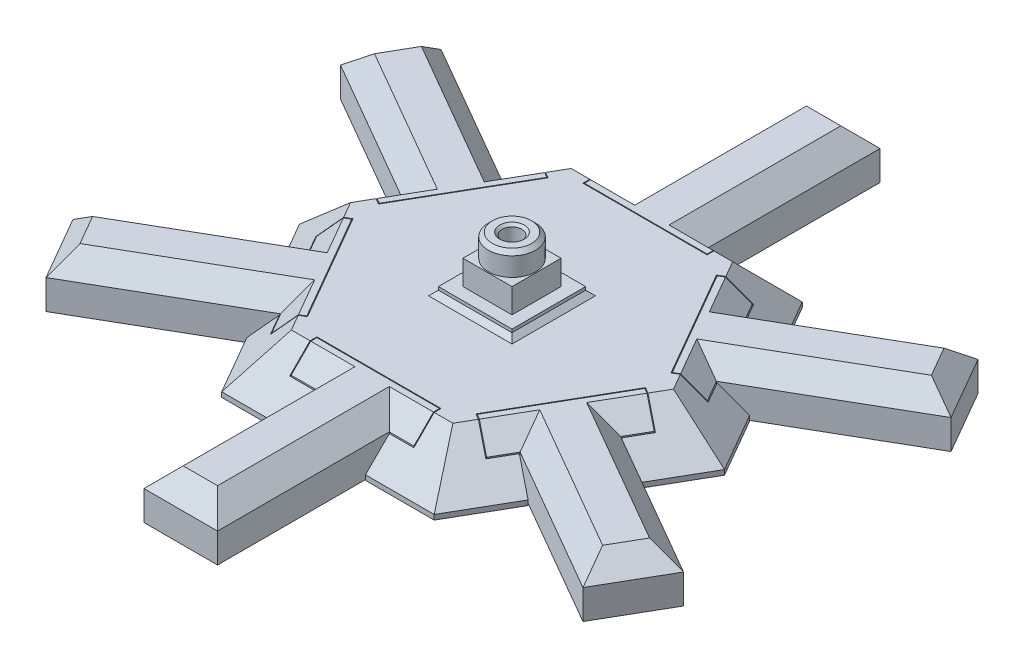
from build123d import *

# Parameters (mm, degrees)
BASE_EXTRUDE_DEPTH           = 10
BOSS_EXTRUDE2_START          = 10
SKETCH3_W                    = 10
SKETCH3_H                    = 10
BOSS_EXTRUDE2_DEPTH          = 11.25
BOSS_EXTRUDE3_START          = 10
SKETCH4_W                    = 15
SKETCH4_H                    = 15
BOSS_EXTRUDE3_DEPTH          = 1.64
CUT_EXTRUDE1_DEPTH           = 5
CUT_EXTRUDE1_DEPTH_BACK      = 62.096747049
CUT_EXTRUDE1_START           = 11.64
SKETCH5_R                    = 2
SKETCH5_2_R                  = 2
CUT_EXTRUDE2_DEPTH           = 62.096747049
CUT_EXTRUDE3_DEPTH           = 4.61
CHAMFER1_SIZE                = 1
F_2_START                    = 16.64
F_2_OFFSET_ROT_OUTLINE_R     = 5
F_2_OFFSET_ROT_OUTLINE_R_2   = 4.8
F_2_OFFSET_ROT_DEPTH         = 4.6100001
F_15_START                   = -1
F_15_OFFSET_HEX_DEPTH        = 17.64
CHAMFER8_SIZE                = 9
CHAMFER9_SIZE                = 1
CHAMFER10_SIZE               = 1
CHAMFER11_SIZE               = 0.5
BOSS_EXTRUDE10_DEPTH         = 10
CHAMFER12_SIZE               = 10
CHAMFER12_SIZE_2             = 1.763269807
CHAMFER13_SIZE               = 4
CHAMFER14_SIZE               = 4
MAKE_START                   = -63.5
MAKE_TOOL_DEPTH              = 36.236730193
MAKE_START_2                 = -28.5
MAKE_TOOL_2_DEPTH            = 1.236730193
MAKE_START_3                 = -7.5
MAKE_TOOL_3_DEPTH            = 15
MAKE_START_4                 = -12.5
MAKE_TOOL_4_DEPTH            = 25
MAKE_START_5                 = -68
MAKE_TOOL_5_DEPTH            = 4.5
DUPLICATE_TOOL_COUNT         = 6
F_15_START_2                 = -12.65
F_15_OFFSET_FOR_FEET_DEPTH   = 25.3
F_15_START_3                 = -7.65
F_15_OFFSET_FOR_FEET_2_DEPTH = 15.3
F_15_OFFSET_FOR_FEET_3_DEPTH = 25.3
F_15_OFFSET_FOR_FEET_4_DEPTH = 15.3
F_15_OFFSET_FOR_FEET_5_DEPTH = 25.3
F_15_OFFSET_FOR_FEET_6_DEPTH = 15.3
DUPLICATE_FEET_COUNT         = 6


with BuildPart() as part:
    # Sketch1 → Base Extrude (new body)
    with BuildSketch(Plane(origin=(0, 0, 0), x_dir=(1, 0, 0), z_dir=(0, 1, 0))):
        Polygon((43.301270189, 0), (21.650635095, 37.5), (-21.650635095, 37.5), (-43.301270189, 0), (-21.650635095, -37.5), (21.650635095, -37.5), align=None)
    extrude(amount=BASE_EXTRUDE_DEPTH)

    # Sketch3 → Boss-Extrude2 (add)
    with BuildSketch(Plane(origin=(0, 0, 0), x_dir=(1, 0, 0), z_dir=(0, 1, 0)).offset(BOSS_EXTRUDE2_START)):
        Rectangle(SKETCH3_W, SKETCH3_H)
    extrude(amount=BOSS_EXTRUDE2_DEPTH)

    # Sketch4 → Boss-Extrude3 (add)
    with BuildSketch(Plane(origin=(0, 0, 0), x_dir=(1, 0, 0), z_dir=(0, 1, 0)).offset(BOSS_EXTRUDE3_START)):
        Rectangle(SKETCH4_W, SKETCH4_H)
    extrude(amount=BOSS_EXTRUDE3_DEPTH)

    # Sketch5 → Cut-Extrude1 (cut, two sides: drawn at the far end of the back side and taken through both)
    with BuildSketch(Plane(origin=(0, 0, 0), x_dir=(1, 0, 0), z_dir=(0, 1, 0)).offset(CUT_EXTRUDE1_START - CUT_EXTRUDE1_DEPTH_BACK)):
        Polygon((4.445597073, 0), (2.222798536, 3.85), (-2.222798536, 3.85), (-4.445597073, 0), (-2.222798536, -3.85), (2.222798536, -3.85), align=None)
        with Locations(Location((0, 0, 0), (0, 0, 270))):
            Circle(SKETCH5_R, mode=Mode.SUBTRACT)
    extrude(amount=CUT_EXTRUDE1_DEPTH + CUT_EXTRUDE1_DEPTH_BACK, mode=Mode.SUBTRACT)

    # Sketch5<2> → Cut-Extrude2 (cut, through all)
    with BuildSketch(Plane(origin=(0, 0, 0), x_dir=(1, 0, 0), z_dir=(0, 1, 0))):
        with Locations(Location((0, 0, 0), (0, 0, 90))):
            Circle(SKETCH5_2_R)
    extrude(amount=CUT_EXTRUDE2_DEPTH, mode=Mode.SUBTRACT)

    # Sketch6 → Cut-Extrude3 (cut)
    with BuildSketch(Plane(origin=(0, 21.25, 0), x_dir=(1, 0, 0), z_dir=(0, 1, 0))):
        with BuildLine():
            Line((-5.7e-08, 5), (-5, 5))
            Line((-5, 5), (-5, 3e-09))
            ThreePointArc((-5, 3e-09), (-3.535533925, 3.535533887), (-5.7e-08, 5))
        make_face()
        with BuildLine():
            Line((5, 5), (-5.7e-08, 5))
            ThreePointArc((-5.7e-08, 5), (3.535533886, 3.535533926), (5, 0))
            Line((5, 0), (5, 5))
        make_face()
        with BuildLine():
            ThreePointArc((5, 0), (3.535533906, -3.535533906), (0, -5))
            Line((0, -5), (5, -5))
            Line((5, -5), (5, 0))
        make_face()
        with BuildLine():
            ThreePointArc((0, -5), (-3.535533907, -3.535533905), (-5, 3e-09))
            Line((-5, 3e-09), (-5, -5))
            Line((-5, -5), (0, -5))
        make_face()
    extrude(amount=-CUT_EXTRUDE3_DEPTH, mode=Mode.SUBTRACT)

    # Chamfer1
    chamfer1_edges = [part.edges().sort_by_distance(p)[0] for p in [
        (0, 21.25, -5),
    ]]
    chamfer(chamfer1_edges, length=CHAMFER1_SIZE)

    # .2 Offset, Rot: read off the stored shape, not the designer's step
    # .2 Offset, Rot outline → .2 Offset, Rot (cut)
    with BuildSketch(Plane(origin=(0, 0, 0), x_dir=(1, 0, 0), z_dir=(0, 1, 0)).offset(F_2_START)):
        Circle(F_2_OFFSET_ROT_OUTLINE_R)
        Circle(F_2_OFFSET_ROT_OUTLINE_R_2, mode=Mode.SUBTRACT)
    extrude(amount=F_2_OFFSET_ROT_DEPTH, mode=Mode.SUBTRACT)

    # .15 Offset, Hex: read off the stored shape, not the designer's step
    # .15 Offset, Hex outline → .15 Offset, Hex (cut)
    with BuildSketch(Plane(origin=(0, 0, 0), x_dir=(1, 0, 0), z_dir=(0, 1, 0)).offset(F_15_START)):
        Polygon((-4.618802154, 0), (-2.309401077, -4), (2.309401077, -4), (4.618802154, 0), (2.309401077, 4), (-2.309401077, 4), align=None)
        Polygon((2.222798536, -3.85), (-2.222798536, -3.85), (-4.445597073, 0), (-2.222798536, 3.85), (2.222798536, 3.85), (4.445597073, 0), align=None, mode=Mode.SUBTRACT)
    extrude(amount=F_15_OFFSET_HEX_DEPTH, mode=Mode.SUBTRACT)

    # Chamfer8
    chamfer8_edges = [part.edges().sort_by_distance(p)[0] for p in [
        (32.475952642, 10, 18.75),
        (32.475952642, 10, -18.75),
        (0, 10, -37.5),
        (-32.475952642, 10, -18.75),
        (-32.475952642, 10, 18.75),
        (0, 10, 37.5),
    ]]
    chamfer(chamfer8_edges, length=CHAMFER8_SIZE)

    # Chamfer9
    chamfer9_edges = [part.edges().sort_by_distance(p)[0] for p in [
        (-3.464101616, 0, 2),
        (-3.464101616, 0, -2),
        (0, 0, -4),
        (3.464101616, 0, -2),
        (3.464101616, 0, 2),
        (0, 0, 4),
    ]]
    chamfer(chamfer9_edges, length=CHAMFER9_SIZE)

    # Chamfer10
    chamfer10_edges = [part.edges().sort_by_distance(p)[0] for p in [
        (0, 10, 7.5),
        (7.5, 10, 0),
        (0, 10, -7.5),
        (-7.5, 10, 0),
    ]]
    chamfer(chamfer10_edges, length=CHAMFER10_SIZE)

    # Chamfer11
    chamfer11_edges = [part.edges().sort_by_distance(p)[0] for p in [
        (0, 21.25, 2),
    ]]
    chamfer(chamfer11_edges, length=CHAMFER11_SIZE)


with BuildPart() as body_2:
    # Boss-Extrude10: read off the stored shape, not the designer's step
    # Boss-Extrude10 outline → Boss-Extrude10 (new body)
    with BuildSketch(Plane(origin=(0, 0, 0), x_dir=(1, 0, 0), z_dir=(0, 1, 0))):
        Polygon((-24.395825623, 22.745190528), (-54.706714755, 40.245190528), (-62.206714755, 27.254809472), (-31.895825623, 9.754809472), (-34.395825623, 5.424682453), (-28.333647797, 1.924682453), (-15.833647797, 23.575317547), (-21.895825623, 27.075317547), align=None)
    extrude(amount=BOSS_EXTRUDE10_DEPTH)

    # Chamfer12
    # the kernel refuses this chamfer: 10, 1.763269807 mm, written as the material it takes off along each edge
    with BuildSketch(Plane(origin=(-41.326341779, 10, 20.579323651), x_dir=(0, -1, 0), z_dir=(0.5000000000105823, 0, -0.866025403778329))) as chamfer12_piece_1:
        Polygon((CHAMFER12_SIZE, 0), (0, CHAMFER12_SIZE_2), (0, 0), align=None)
    extrude(amount=76.970775928, mode=Mode.SUBTRACT)

    # Chamfer13
    chamfer13_edges = [body_2.edges().sort_by_distance(p)[0] for p in [
        (-47.051270189, 10, -18.504809472),
        (-39.551270189, 10, -31.495190528),
        (-58.456714755, 10, -33.75),
    ]]
    chamfer(chamfer13_edges, length=CHAMFER13_SIZE)

    # Chamfer14
    chamfer14_edges = [body_2.edges().sort_by_distance(p)[0] for p in [
        (-24.145825623, 10, -23.17820323),
        (-32.145825623, 10, -9.32179677),
    ]]
    chamfer(chamfer14_edges, length=CHAMFER14_SIZE)


with BuildPart() as body_3:
    # Make Tool: read off the stored shape, not the designer's step
    # Make Tool outline → Make Tool (new body)
    with BuildSketch(Plane(origin=(0, 0, 0), x_dir=(0.4999999999999988, 0, -0.8660254037844395), z_dir=(0.8660254037844393, 0, 0.4999999999999991)).offset(MAKE_START)):
        Polygon((-7.5, 6), (-7.5, 0), (7.5, 0), (7.5, 6), (3.5, 10), (-3.5, 10), align=None)
    extrude(amount=MAKE_TOOL_DEPTH)

    # Make Tool 2 outline → Make Tool 2 (add)
    with BuildSketch(Plane(origin=(0, 0, 0), x_dir=(0.4999999999999988, 0, -0.8660254037844395), z_dir=(0.8660254037844393, 0, 0.4999999999999991)).offset(MAKE_START_2)):
        Polygon((-12.5, 0), (-7.5, 0), (-7.5, 6), (-3.5, 10), (-12.5, 10), align=None)
        Polygon((7.5, 6), (7.5, 0), (12.5, 0), (12.5, 10), (3.5, 10), align=None)
    extrude(amount=MAKE_TOOL_2_DEPTH)

    # Make Tool 3 outline → Make Tool 3 (add)
    with BuildSketch(Plane(origin=(0, 0, 0), x_dir=(0.8660254037844384, 0, 0.5000000000000003), z_dir=(0.5000000000000003, 0, -0.8660254037844385)).offset(MAKE_START_3)):
        Polygon((-63.5, 0), (-67.5, 0), (-67.5, -6), (-63.5, -10), align=None)
        Polygon((-25.5, 0), (-27.263269807, 0), (-27.263269807, -10), align=None)
        Polygon((-28.5, 0), (-32.5, 0), (-32.5, -6), (-28.5, -10), align=None)
    extrude(amount=MAKE_TOOL_3_DEPTH)

    # Make Tool 4 outline → Make Tool 4 (add)
    with BuildSketch(Plane(origin=(0, 0, 0), x_dir=(0.8660254037844384, 0, 0.5000000000000003), z_dir=(0.5000000000000003, 0, -0.8660254037844385)).offset(MAKE_START_4)):
        Polygon((-25.5, 0), (-27.263269807, 0), (-27.263269807, -10), align=None)
        Polygon((-28.5, 0), (-32.5, 0), (-32.5, -6), (-28.5, -10), align=None)
    extrude(amount=MAKE_TOOL_4_DEPTH)

    # Make Tool 5 outline → Make Tool 5 (cut)
    with BuildSketch(Plane(origin=(0, 0, 0), x_dir=(0.4999999999999988, 0, -0.8660254037844394), z_dir=(0.8660254037844393, 0, 0.49999999999999906)).offset(MAKE_START_5)):
        Polygon((7.5, 10), (3.5, 10), (7.5, 6), align=None)
        Polygon((-3.5, 10), (-7.5, 10), (-7.5, 6), align=None)
    extrude(amount=MAKE_TOOL_5_DEPTH, mode=Mode.SUBTRACT)


with BuildPart() as duplicate_tool_1:
    # Duplicate Tool: pattern copy
    add(body_3.part.rotate(Axis((0, 0, 0), (0, 1, 0)), 1 * 360 / DUPLICATE_TOOL_COUNT))


with BuildPart() as duplicate_tool_2:
    # Duplicate Tool: pattern copy
    add(body_3.part.rotate(Axis((0, 0, 0), (0, 1, 0)), 2 * 360 / DUPLICATE_TOOL_COUNT))


with BuildPart() as duplicate_tool_3:
    # Duplicate Tool: pattern copy
    add(body_3.part.rotate(Axis((0, 0, 0), (0, 1, 0)), 3 * 360 / DUPLICATE_TOOL_COUNT))


with BuildPart() as duplicate_tool_4:
    # Duplicate Tool: pattern copy
    add(body_3.part.rotate(Axis((0, 0, 0), (0, 1, 0)), 4 * 360 / DUPLICATE_TOOL_COUNT))


with BuildPart() as duplicate_tool_5:
    # Duplicate Tool: pattern copy
    add(body_3.part.rotate(Axis((0, 0, 0), (0, 1, 0)), 5 * 360 / DUPLICATE_TOOL_COUNT))


with BuildPart() as part_1:
    add(part.part)

    # Make Feet Cutout: read off the stored shape, not the designer's step
    # Make Feet Cutout: cut Duplicate Tool_2, Duplicate Tool_3, Duplicate Tool_4, Duplicate Tool_5, Duplicate Tool_1, body 2
    add(duplicate_tool_2.part, mode=Mode.SUBTRACT)
    add(duplicate_tool_3.part, mode=Mode.SUBTRACT)
    add(duplicate_tool_4.part, mode=Mode.SUBTRACT)
    add(duplicate_tool_5.part, mode=Mode.SUBTRACT)
    add(duplicate_tool_1.part, mode=Mode.SUBTRACT)
    add(body_2.part, mode=Mode.SUBTRACT)

    # .15 Offset for feet: read off the stored shape, not the designer's step
    # .15 Offset for feet outline → .15 Offset for feet (cut)
    with BuildSketch(Plane(origin=(0, 0, 0), x_dir=(0.8660254037844386, 0, 0.4999999999999999), z_dir=(0.4999999999999999, 0, -0.8660254037844388)).offset(F_15_START_2)):
        Polygon((-32.65, 0), (-32.65, -5.85), (-28.5, -10), (-27.110955815, -10), (-25.347686008, 0), align=None)
        Polygon((25.347686008, 0), (27.110955815, -10), (28.5, -10), (32.65, -5.85), (32.65, 0), align=None)
    extrude(amount=F_15_OFFSET_FOR_FEET_DEPTH, mode=Mode.SUBTRACT)

    # 15 Offset for feet 2 outline → 15 Offset for feet 2 (cut)
    with BuildSketch(Plane(origin=(0, 0, 0), x_dir=(0.8660254037844386, 0, 0.4999999999999999), z_dir=(0.4999999999999999, 0, -0.8660254037844388)).offset(F_15_START_3)):
        Polygon((-37.5, -1), (-32.65, -5.85), (-32.65, 0), (-37.5, 0), align=None)
        Polygon((37.5, 0), (32.65, 0), (32.65, -5.85), (37.5, -1), align=None)
    extrude(amount=F_15_OFFSET_FOR_FEET_2_DEPTH, mode=Mode.SUBTRACT)

    # 15 Offset for feet 3 outline → 15 Offset for feet 3 (cut)
    with BuildSketch(Plane(origin=(0, 0, 0), x_dir=(0.8660254037844446, 0, -0.4999999999999897), z_dir=(0.4999999999999897, 0, 0.8660254037844446)).offset(F_15_START_2)):
        Polygon((-32.65, 5.85), (-32.65, 0), (-25.347686008, 0), (-27.110955815, 10), (-28.5, 10), align=None)
        Polygon((27.110955815, 10), (25.347686008, 0), (32.65, 0), (32.65, 5.85), (28.5, 10), align=None)
    extrude(amount=F_15_OFFSET_FOR_FEET_3_DEPTH, mode=Mode.SUBTRACT)

    # 15 Offset for feet 4 outline → 15 Offset for feet 4 (cut)
    with BuildSketch(Plane(origin=(0, 0, 0), x_dir=(0.8660254037844446, 0, -0.4999999999999897), z_dir=(0.4999999999999897, 0, 0.8660254037844446)).offset(F_15_START_3)):
        Polygon((-37.5, 0), (-32.65, 0), (-32.65, 5.85), (-37.5, 1), align=None)
        Polygon((32.65, 5.85), (32.65, 0), (37.5, 0), (37.5, 1), align=None)
    extrude(amount=F_15_OFFSET_FOR_FEET_4_DEPTH, mode=Mode.SUBTRACT)

    # 15 Offset for feet 5 outline → 15 Offset for feet 5 (cut)
    with BuildSketch(Plane.YZ.offset(F_15_START_2)):
        Polygon((0, -32.65), (5.85, -32.65), (10, -28.5), (10, -27.110955815), (0, -25.347686008), align=None)
        Polygon((0, 25.347686008), (10, 27.110955815), (10, 28.5), (5.85, 32.65), (0, 32.65), align=None)
    extrude(amount=F_15_OFFSET_FOR_FEET_5_DEPTH, mode=Mode.SUBTRACT)

    # 15 Offset for feet 6 outline → 15 Offset for feet 6 (cut)
    with BuildSketch(Plane.YZ.offset(F_15_START_3)):
        Polygon((1, -37.5), (5.85, -32.65), (0, -32.65), (0, -37.5), align=None)
        Polygon((0, 37.5), (0, 32.65), (5.85, 32.65), (1, 37.5), align=None)
    extrude(amount=F_15_OFFSET_FOR_FEET_6_DEPTH, mode=Mode.SUBTRACT)


with BuildPart() as duplicate_feet_1:
    # Duplicate Feet: pattern copy
    add(body_3.part.rotate(Axis((0, 0, 0), (0, 1, 0)), 1 * 360 / DUPLICATE_FEET_COUNT))


with BuildPart() as duplicate_feet_2:
    # Duplicate Feet: pattern copy
    add(body_3.part.rotate(Axis((0, 0, 0), (0, 1, 0)), 2 * 360 / DUPLICATE_FEET_COUNT))


with BuildPart() as duplicate_feet_3:
    # Duplicate Feet: pattern copy
    add(body_3.part.rotate(Axis((0, 0, 0), (0, 1, 0)), 3 * 360 / DUPLICATE_FEET_COUNT))


with BuildPart() as duplicate_feet_4:
    # Duplicate Feet: pattern copy
    add(body_3.part.rotate(Axis((0, 0, 0), (0, 1, 0)), 4 * 360 / DUPLICATE_FEET_COUNT))


with BuildPart() as duplicate_feet_5:
    # Duplicate Feet: pattern copy
    add(body_3.part.rotate(Axis((0, 0, 0), (0, 1, 0)), 5 * 360 / DUPLICATE_FEET_COUNT))


solid = Compound([body_3.part, part_1.part, duplicate_feet_1.part, duplicate_feet_2.part, duplicate_feet_3.part, duplicate_feet_4.part, duplicate_feet_5.part])
